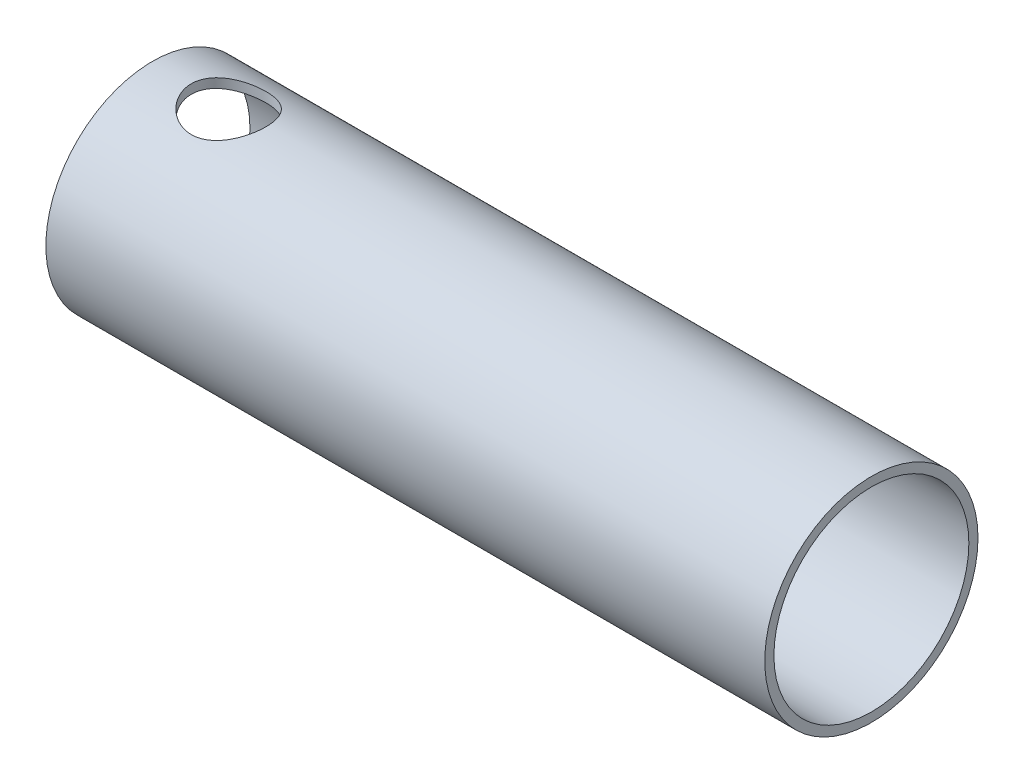
from build123d import *

# Parameters (mm, degrees)
SKETCH3_R               = 35
SKETCH3_R_2             = 32
BOSS_EXTRUDE1_DEPTH     = 236
CUT_EXTRUDE1_DEPTH      = 242.134817063
CUT_EXTRUDE1_DEPTH_BACK = 242.134817063
SKETCH4_R               = 12.25


with BuildPart() as part:
    # Sketch3 → Boss-Extrude1 (new body)
    with BuildSketch(Plane(origin=(0, 0, 0), x_dir=(0, 0, -1), z_dir=(1, 0, 0))):
        Circle(SKETCH3_R)
        Circle(SKETCH3_R_2, mode=Mode.SUBTRACT)
    extrude(amount=BOSS_EXTRUDE1_DEPTH)

    # Sketch4 → Cut-Extrude1 (cut, two sides: drawn at the far end of the back side and taken through both)
    with BuildSketch(Plane(origin=(0, 0, 0), x_dir=(1, 0, 0), z_dir=(0, 1, 0)).offset(-CUT_EXTRUDE1_DEPTH_BACK)):
        with Locations((25, 0)):
            Circle(SKETCH4_R)
    extrude(amount=CUT_EXTRUDE1_DEPTH + CUT_EXTRUDE1_DEPTH_BACK, mode=Mode.SUBTRACT)


solid = part.part
